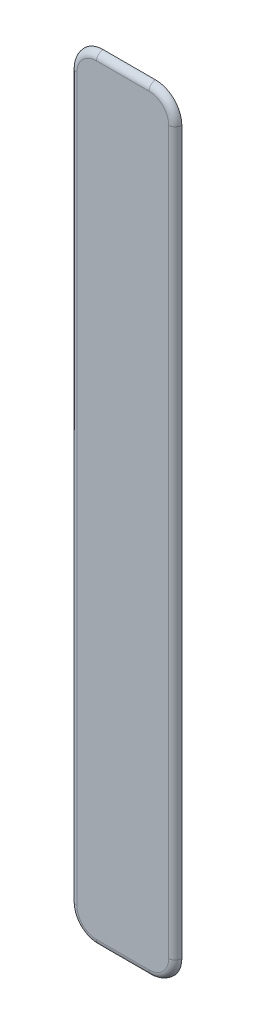
from build123d import *

# Parameters (mm, degrees)
SKETCH_1_W      = 16
SKETCH_1_H      = 118
EXTRUDE_1_DEPTH = 1
FILLET_1_R      = 4
FILLET_2_R      = 1


with BuildPart() as part:
    # Эскиз1 → Бобышка-Вытянуть1 (new body)
    with BuildSketch(Plane.XY):
        with Locations((8, 59)):
            Rectangle(SKETCH_1_W, SKETCH_1_H)
    extrude(amount=EXTRUDE_1_DEPTH)

    # Скругление1
    fillet_1_edges = [part.edges().sort_by_distance(p)[0] for p in [
        (0, 118, 0.5),
        (16, 118, 0.5),
        (16, 0, 0.5),
        (0, 0, 0.5),
    ]]
    fillet(fillet_1_edges, radius=FILLET_1_R)

    # Скругление2
    fillet_2_edges = [part.edges().sort_by_distance(p)[0] for p in [
        (1.171572875, 116.828427125, 1),
        (8, 118, 1),
        (14.828427125, 116.828427125, 1),
        (16, 59, 1),
        (14.828427125, 1.171572875, 1),
        (8, 0, 1),
        (1.171572875, 1.171572875, 1),
        (0, 59, 1),
    ]]
    fillet(fillet_2_edges, radius=FILLET_2_R - 0.0001)  # a hair under: the kernel refuses the full size


solid = part.part
